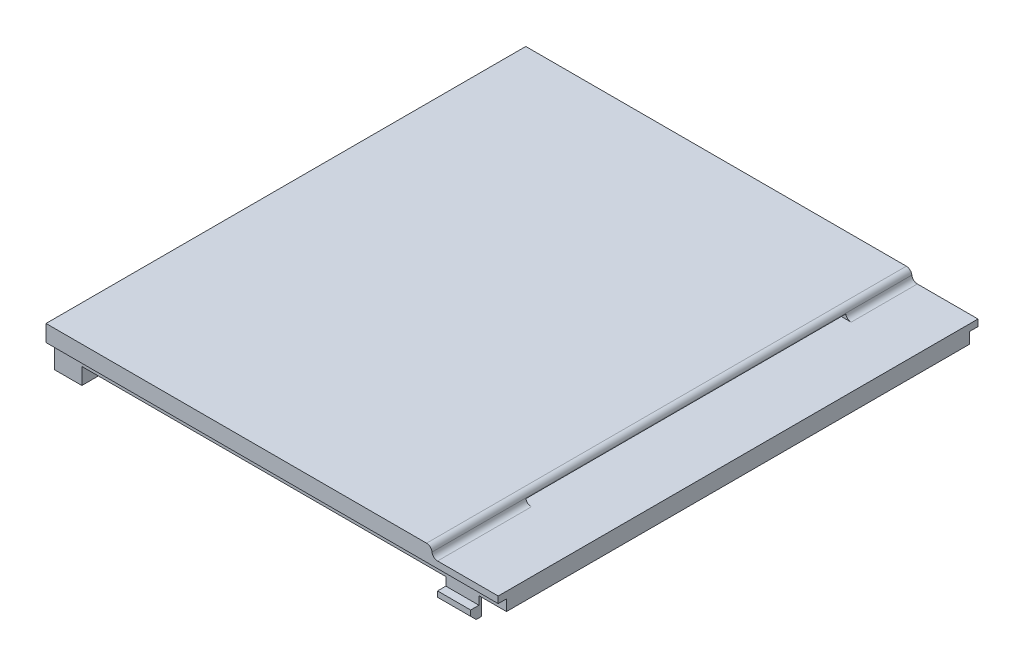
from build123d import *

# Parameters (mm, degrees)
SKETCH_2_W          = 87
SKETCH_2_H          = 3
SKETCH_2_W_2        = 2
SKETCH_2_H_2        = 2
SKETCH_2_W_3        = 80
EXTRUDE_1_DEPTH     = 82
SKETCH_3_W          = 84
SKETCH_3_H          = 8
EXTRUDE_2_DEPTH     = 5
SKETCH_3_3_W        = 9.6
SKETCH_3_3_H        = 1.5
EXTRUDE_3_DEPTH     = 2
SKETCH_4_W          = 58
SKETCH_4_H          = 0.8
CUT_EXTRUDE_1_DEPTH = 94.051061251
FILLET_1_R          = 1.2
CUT_EXTRUDE_START   = -0.3
CUT_EXTRUDE_2_DEPTH = 94.351061251
EXTRUDE_START       = 71
EXTRUDE_4_DEPTH     = 6
FILLET_2_R          = 1
FILLET_3_R          = 1


# Some blends are built 0.0001 mm under size
with BuildPart() as part:
    # Эскиз2 → Бобышка-Вытянуть1 (new body)
    with BuildSketch(Plane(origin=(0, 0, 0), x_dir=(0, 0, -1), z_dir=(1, 0, 0))):
        Rectangle(SKETCH_2_W, SKETCH_2_H)
        with Locations((-41, -2.5)):
            Rectangle(SKETCH_2_W_2, SKETCH_2_H_2)
        with Locations((41, -2.5)):
            Rectangle(SKETCH_2_W_2, SKETCH_2_H_2)
        with Locations((0, -2.5)):
            Rectangle(SKETCH_2_W_3, SKETCH_2_H_2)
    extrude(amount=EXTRUDE_1_DEPTH)

    # Эскиз3 → Бобышка-Вытянуть2 (add)
    with BuildSketch(Plane(origin=(0, 0, 0), x_dir=(0, 0, -1), z_dir=(1, 0, 0))):
        with Locations((0, -2.5)):
            Rectangle(SKETCH_3_W, SKETCH_3_H)
    extrude(amount=EXTRUDE_2_DEPTH)

    # Эскиз3<3> → Бобышка-Вытянуть3 (add)
    with BuildSketch(Plane(origin=(0, 0, 0), x_dir=(0, 0, -1), z_dir=(1, 0, 0))):
        with Locations((30, -3.9)):
            Rectangle(SKETCH_3_3_W, SKETCH_3_3_H)
        with Locations((0, -3.9)):
            Rectangle(SKETCH_3_3_W, SKETCH_3_3_H)
        with Locations((-30, -3.9)):
            Rectangle(SKETCH_3_3_W, SKETCH_3_3_H)
    extrude(amount=-EXTRUDE_3_DEPTH)

    # Эскиз4 → Вырез-Вытянуть1 (cut, through all)
    with BuildSketch(Plane(origin=(0, 0, 0), x_dir=(0, 0, -1), z_dir=(1, 0, 0))):
        with Locations((2.5, 0.1)):
            Rectangle(SKETCH_4_W, SKETCH_4_H)
    extrude(amount=CUT_EXTRUDE_1_DEPTH, mode=Mode.SUBTRACT)

    # Скругление1
    fillet_1_edges = [part.edges().sort_by_distance(p)[0] for p in [
        (0, -0.3, -2.5),
    ]]
    fillet(fillet_1_edges, radius=FILLET_1_R)

    # Эскиз5 → Вырез-Вытянуть2 (cut, through all)
    with BuildSketch(Plane(origin=(0, 0, 0), x_dir=(1, 0, 0), z_dir=(0, 1, 0)).offset(CUT_EXTRUDE_START)):
        Polygon((70, -47.531126979), (70, 0), (70, 45.964828752), (87.651611458, 45.964828752), (87.651611458, -47.531126979), align=None)
    extrude(amount=CUT_EXTRUDE_2_DEPTH, mode=Mode.SUBTRACT)

    # Эскиз6 → Бобышка-Вытянуть4 (add)
    with BuildSketch(Plane(origin=(0, 0, 0), x_dir=(0, 0, -1), z_dir=(1, 0, 0)).offset(EXTRUDE_START)):
        Polygon((-41.5, -3.049635954), (-42, -3.049635954), (-42, -5), (-43.5, -5), (-43.5, -6), (-42.5, -7), (-42, -7), (-41.5, -7), align=None)
    extrude_4 = extrude(amount=EXTRUDE_4_DEPTH)

    # Скругление2
    # the kernel refuses this fillet: 1 mm, written as the material it adds along each edge
    with BuildSketch(Plane(origin=(70, -0.3, 24), x_dir=(1, 0, 0), z_dir=(0, 0, 1))) as fillet_2_piece_1_section:
        with BuildLine():
            CenterArc((FILLET_2_R, FILLET_2_R), FILLET_2_R, 180, 90)
            Line((0, FILLET_2_R), (-FILLET_2_R * 0.02, FILLET_2_R))
            Line((-FILLET_2_R * 0.02, FILLET_2_R), (-FILLET_2_R * 0.02, -FILLET_2_R * 0.02))
            Line((-FILLET_2_R * 0.02, -FILLET_2_R * 0.02), (FILLET_2_R, -FILLET_2_R * 0.02))
            Line((FILLET_2_R, -FILLET_2_R * 0.02), (FILLET_2_R, 0))
        make_face()
    fillet_2_piece_1 = extrude(amount=19.5, mode=Mode.PRIVATE)
    fillet_2_piece_1 = split(fillet_2_piece_1, bisect_by=Plane(origin=(69.994030939, 0.5, 25.25), z_dir=(0, 1, 0)), keep=Keep.TOP, mode=Mode.PRIVATE)
    fillet_2_piece_1 = split(fillet_2_piece_1, bisect_by=Plane(origin=(69.994030939, 0.587417507, 26.5), z_dir=(0, 0, -1)), keep=Keep.TOP, mode=Mode.PRIVATE)
    with BuildSketch(Plane(origin=(70, -0.3, 26.5), x_dir=(1, 0, 0), z_dir=(0, 0, 1))) as fillet_2_piece_2_section:
        with BuildLine():
            CenterArc((FILLET_2_R, FILLET_2_R), FILLET_2_R, 180, 90)
            Line((0, FILLET_2_R), (-FILLET_2_R * 0.02, FILLET_2_R))
            Line((-FILLET_2_R * 0.02, FILLET_2_R), (-FILLET_2_R * 0.02, -FILLET_2_R * 0.02))
            Line((-FILLET_2_R * 0.02, -FILLET_2_R * 0.02), (FILLET_2_R, -FILLET_2_R * 0.02))
            Line((FILLET_2_R, -FILLET_2_R * 0.02), (FILLET_2_R, 0))
        make_face()
    fillet_2_piece_2 = extrude(amount=17, mode=Mode.PRIVATE)
    fillet_2_piece_2 = split(fillet_2_piece_2, bisect_by=Plane(origin=(70.231366514, 0.5, 35), z_dir=(0, -1, 0)), keep=Keep.TOP, mode=Mode.PRIVATE)
    with BuildSketch(Plane(origin=(70, -0.3, 26.5), x_dir=(1, 0, 0), z_dir=(0, 0, 1))) as fillet_2_piece_3_section:
        with BuildLine():
            CenterArc((FILLET_2_R, FILLET_2_R), FILLET_2_R, 180, 90)
            Line((0, FILLET_2_R), (-FILLET_2_R * 0.02, FILLET_2_R))
            Line((-FILLET_2_R * 0.02, FILLET_2_R), (-FILLET_2_R * 0.02, -FILLET_2_R * 0.02))
            Line((-FILLET_2_R * 0.02, -FILLET_2_R * 0.02), (FILLET_2_R, -FILLET_2_R * 0.02))
            Line((FILLET_2_R, -FILLET_2_R * 0.02), (FILLET_2_R, 0))
        make_face()
    fillet_2_piece_3 = extrude(amount=17, mode=Mode.PRIVATE)
    fillet_2_piece_3 = split(fillet_2_piece_3, bisect_by=Plane(origin=(69.994030939, 0.5, 35), z_dir=(0, 1, 0)), keep=Keep.TOP, mode=Mode.PRIVATE)
    add([fillet_2_piece_1, fillet_2_piece_2, fillet_2_piece_3])
    fillet_2_2_edges = [part.edges().sort_by_distance(p)[0] for p in [
        (70, -0.3, -37.5),
    ]]
    fillet(fillet_2_2_edges, radius=FILLET_2_R - 0.0001)  # a hair under: the kernel refuses the full size

    # Зеркальное отражение1: Бобышка-Вытянуть4 across plane
    add(extrude_4.mirror(Plane.XY))

    # Скругление3
    # the kernel refuses this fillet: 1 mm, written as the material it takes off along each edge
    with BuildSketch(Plane(origin=(70, 1.5, -45.974961047), x_dir=(0.005563569274726223, -0.9999845232286975, 0), z_dir=(0, 0, 1))) as fillet_3_piece_1:
        with BuildLine():
            CenterArc((0.994476676, -0.995532666), FILLET_3_R, 95.417808371, 84.263420946)
            Line((-0.005507847, -0.989969097), (-0.105506299, -0.98941274))
            Line((-0.105506299, -0.98941274), (-0.099998452, 0.000556357))
            Line((-0.099998452, 0.000556357), (0.000556357, 0.099998452))
            ThreePointArc((0.000556357, 0.099998452), (0.800643974, 0.095547041), (0.890617158, 0.099553267))
            Line((0.890617158, 0.099553267), (0.900058932, 0))
        make_face()
    fillet_3_piece_1_solid = extrude(amount=69.974960039, mode=Mode.PRIVATE)
    with BuildSketch(Plane(origin=(70, 1.5, 23.999998992), x_dir=(0.00556942794624549, -0.9999844906159053, 0), z_dir=(0, 0, 1))) as fillet_3_piece_2:
        with BuildLine():
            CenterArc((0.994470897, -0.995528948), FILLET_3_R, 95.420064112, 84.260829523)
            Line((-0.005513594, -0.98995952), (-0.105512043, -0.989402578))
            Line((-0.105512043, -0.989402578), (-0.099998449, 0.000556943))
            Line((-0.099998449, 0.000556943), (0.000556943, 0.099998449))
            ThreePointArc((0.000556943, 0.099998449), (0.800544535, 0.095542907), (0.890568265, 0.099552895))
            Line((0.890568265, 0.099552895), (0.900013959, 0))
        make_face()
    fillet_3_piece_2_solid = extrude(amount=21.974938193, mode=Mode.PRIVATE)
    add([fillet_3_piece_1_solid, fillet_3_piece_2_solid], mode=Mode.SUBTRACT)


solid = part.part
